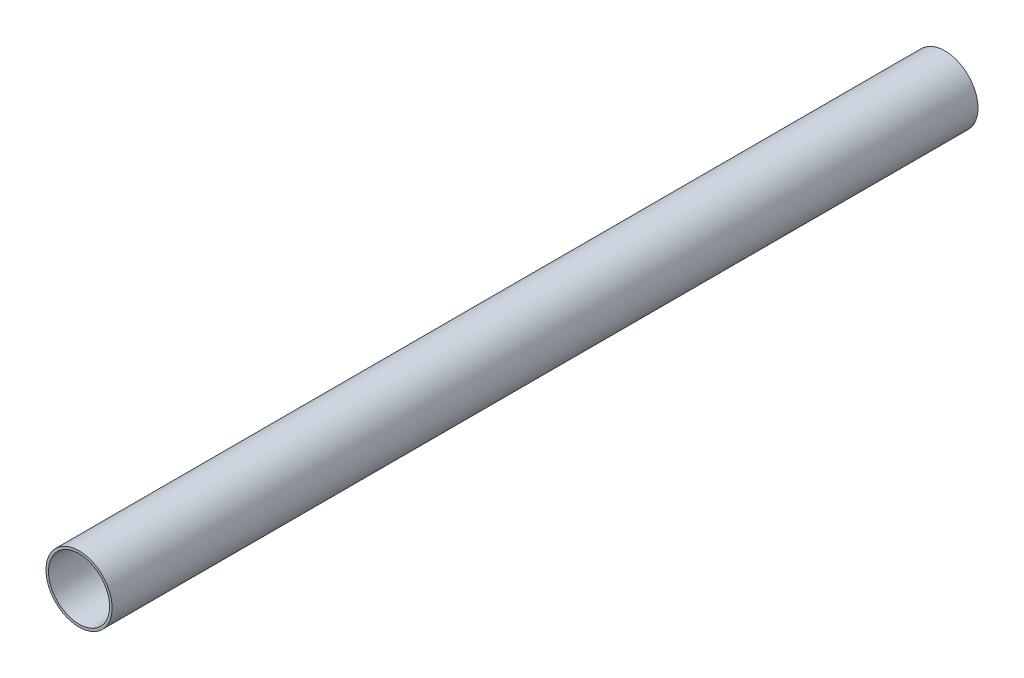
from build123d import *

# Parameters (mm, degrees)
SKETCH1_R      = 20.6375
SKETCH1_R_2    = 19.05
EXTRUDE1_DEPTH = 540


with BuildPart() as part:
    # Sketch1 → Extrude1 (new body)
    with BuildSketch(Plane.XY):
        Circle(SKETCH1_R)
        Circle(SKETCH1_R_2, mode=Mode.SUBTRACT)
    extrude(amount=EXTRUDE1_DEPTH)


solid = part.part
